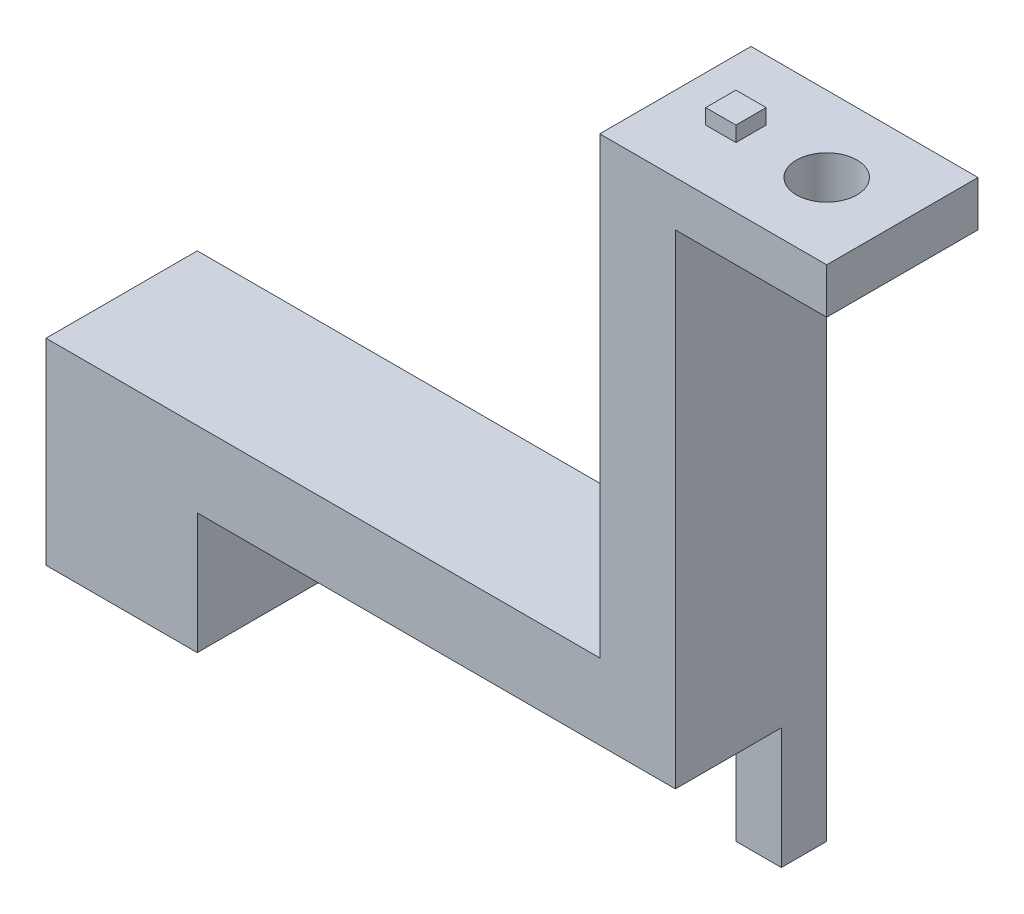
from build123d import *

# Parameters (mm, degrees)
BOSS_EXTRUDE1_DEPTH = 10
SKETCH2_W           = 5.1
SKETCH2_H           = 3.1
CUT_EXTRUDE1_DEPTH  = 10
SKETCH3_W           = 2
SKETCH3_H           = 2
BOSS_EXTRUDE2_DEPTH = 1
CUT_EXTRUDE4_REACH  = 69.908
SKETCH11_R          = 2
SKETCH12_W          = 3
SKETCH12_H          = 3
BOSS_EXTRUDE4_DEPTH = 8


with BuildPart() as part:
    # Sketch1 → Boss-Extrude1 (new body)
    with BuildSketch(Plane.XY):
        Polygon((10, 13), (36.6, 13), (36.6, 43), (51.6, 43), (51.6, 40), (41.6, 40), (41.6, 8), (10, 8), (10, 0), (0, 0), (0, 13), align=None)
    extrude(amount=BOSS_EXTRUDE1_DEPTH)

    # Sketch2 → Cut-Extrude1 (cut)
    with BuildSketch(Plane.XZ):
        with Locations((5, 5)):
            Rectangle(SKETCH2_W, SKETCH2_H)
    extrude(amount=-CUT_EXTRUDE1_DEPTH, mode=Mode.SUBTRACT)

    # Sketch3 → Boss-Extrude2 (add)
    with BuildSketch(Plane(origin=(0, 43, 0), x_dir=(1, 0, 0), z_dir=(0, 1, 0))):
        with Locations((40.6, -5)):
            Rectangle(SKETCH3_W, SKETCH3_H)
    extrude(amount=BOSS_EXTRUDE2_DEPTH)

    # Sketch11 → Cut-Extrude4 (cut, up to next)
    with BuildSketch(Plane(origin=(0, 43, 0), x_dir=(1, 0, 0), z_dir=(0, 1, 0)), mode=Mode.PRIVATE) as cut_extrude4_sk1:
        with Locations((46.6, -5)):
            Circle(SKETCH11_R)
    cut_extrude4_tool1 = extrude(cut_extrude4_sk1.sketch, amount=-CUT_EXTRUDE4_REACH, mode=Mode.PRIVATE) & part.part
    add(cut_extrude4_tool1.solids().sort_by_distance((46.6, 43, 5))[0], mode=Mode.SUBTRACT)

    # Sketch12 → Boss-Extrude4 (add)
    with BuildSketch(Plane.XZ.offset(-8)):
        with Locations((40.1, 1.5)):
            Rectangle(SKETCH12_W, SKETCH12_H)
    extrude(amount=BOSS_EXTRUDE4_DEPTH)


solid = part.part
